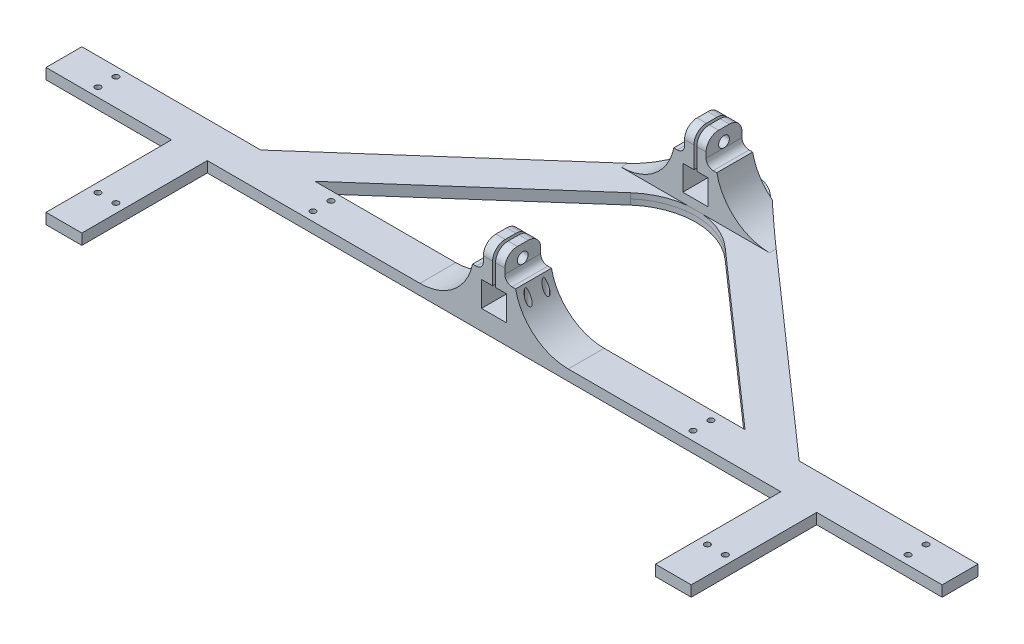
from build123d import *

# Parameters (mm, degrees)
EXTRUDE_1_DEPTH      = 1.5
EXTRUDE_10_DEPTH     = 1.5
FILLET_1_R           = 10
FILLET_2_R           = 20
EXTRUDE_11_DEPTH     = 20
EXTRUDE_13_DEPTH     = 35
EXTRUDE_14_DEPTH     = 35
EXTRUDE_15_DEPTH     = 1.5
FILLET_5_R           = 20
FILLET_6_R           = 10
SKETCH_58_R          = 0.8000000000000042
SKETCH_58_R_2        = 0.8000000000000055
SKETCH_58_R_3        = 0.8000000000000044
SKETCH_58_R_4        = 0.7999999999999963
SKETCH_58_R_5        = 0.8000000000000119
SKETCH_58_R_6        = 0.7999999999999946
SKETCH_58_R_7        = 0.7999999999999954
SKETCH_58_R_8        = 0.7999999999999948
SKETCH_58_R_9        = 0.8000000000000026
CUT_EXTRUDE_52_DEPTH = 145.10569310974057
SKETCH_26_W          = 22
SKETCH_26_H          = 10
EXTRUDE_16_DEPTH     = 20
CUT_EXTRUDE_53_DEPTH = 163.22491745731594
FILLET_7_R           = 15
FILLET_8_R           = 15
FILLET_9_R           = 3.5
SKETCH_60_R          = 1.5000000000000042
CUT_EXTRUDE_54_DEPTH = 147.3444593643323
SKETCH_61_R          = 1.5000000000000004
CUT_EXTRUDE_55_DEPTH = 147.3444593643323
FILLET_10_R          = 2


# Some blends are built 0.0001 mm under size
with BuildPart() as part:
    # 草图1 → 凸台-拉伸1 (new body)
    with BuildSketch(Plane(origin=(0, 0, 0), x_dir=(1, 0, 0), z_dir=(0, 1, 0))):
        Polygon((-125, 4.999999999999984), (124.99999999999996, 4.999999999999984), (124.99999999999996, -5.0000000000000115), (-125.00000000000003, -5.0000000000000115), align=None)
    extrude(amount=EXTRUDE_1_DEPTH)



with BuildPart() as body_2:
    # 草图22 → 凸台-拉伸10 (new body)
    with BuildSketch(Plane.XZ):
        Polygon((-3.09e-14, -71.24835955462486), (-3.362e-14, -57.91502622129154), (-60.00000000000021, -4.9999999999999805), (-75.11857892036937, -4.9999999999999805), align=None)
        Polygon((60.00000000000021, -4.9999999999999645), (1.388e-14, -57.91502622129154), (-3.09e-14, -71.24835955462486), (75.1185789203694, -4.999999999999957), align=None)
    extrude(amount=-EXTRUDE_10_DEPTH)

    # 圆角1
    fillet_1_edges = [body_2.edges().sort_by_distance(p)[0] for p in [
        (-8.35e-15, 0.75, -71.24835955462484),
    ]]
    fillet(fillet_1_edges, radius=FILLET_1_R)

    # 圆角2
    fillet_2_edges = [body_2.edges().sort_by_distance(p)[0] for p in [
        (-9.71e-15, 0.75, -57.91502622129154),
    ]]
    fillet(fillet_2_edges, radius=FILLET_2_R)


with BuildPart() as part_1:
    add(part.part)

    add(body_2.part)  # 凸台-拉伸11 merges body 2
    # 草图24 → 凸台-拉伸11 (add)
    with BuildSketch(Plane(origin=(0, 1.5, 0), x_dir=(1, 0, 0), z_dir=(0, 1, 0))):
        Polygon((-10.000000000000004, 4.999999999999999), (9.999999999999996, 4.999999999999999), (9.999999999999996, -5.000000000000001), (-10.000000000000002, -5.000000000000001), align=None)
    extrude(amount=EXTRUDE_11_DEPTH)

    # 草图41 → 凸台-拉伸13 (add)
    with BuildSketch(Plane.XY.offset(5.0000000000000115)):
        Polygon((89.99999999999996, 1.4999999999999951), (79.99999999999996, 1.4999999999999951), (79.99999999999996, -4.88e-15), (89.99999999999996, -4.99e-15), (89.99999999999996, 0.7499999999999958), align=None)
    extrude(amount=EXTRUDE_13_DEPTH)

    # 草图42 → 凸台-拉伸14 (add)
    with BuildSketch(Plane.XY.offset(5.0000000000000115)):
        Polygon((-80, 1.4999999999999998), (-90, 1.4999999999999998), (-90, 0.75), (-90, -2.2e-16), (-80, -2.2e-16), align=None)
    extrude(amount=EXTRUDE_14_DEPTH)

    # 草图57 → 凸台-拉伸15 (add)
    with BuildSketch(Plane(origin=(0, 0, 0), x_dir=(-1, 0, 0), z_dir=(0, -1, 0))):
        Polygon((125.00000000000003, -5.0000000000000115), (90, -5.0000000000000115), (90, -40.000000000000014), (80, -40.000000000000014), (80, -5.0000000000000115), (-79.99999999999996, -5.0000000000000115), (-79.99999999999996, -40.000000000000014), (-89.99999999999996, -40.000000000000014), (-89.99999999999994, -5.0000000000000115), (-124.99999999999996, -5.0000000000000115), (-124.99999999999996, 4.999999999999984), (-75.11857892036936, 4.999999999999984), (-6.614378277661482, 65.41502622129155), (-3.024e-14, 71.24835955462483), (6.614378277661415, 65.41502622129157), (75.11857892036936, 4.999999999999984), (125, 4.999999999999984), align=None)
        Polygon((60.00000000000022, 4.999999999999984), (-60.00000000000011, 4.999999999999984), (-2.082e-14, 57.915026221291534), align=None, mode=Mode.SUBTRACT)
    extrude(amount=EXTRUDE_15_DEPTH)

    # 圆角5
    fillet_5_edges = [part_1.edges().sort_by_distance(p)[0] for p in [
        (2.082e-14, -0.75, -57.915026221291534),
    ]]
    fillet(fillet_5_edges, radius=FILLET_5_R)

    # 圆角6
    fillet_6_edges = [part_1.edges().sort_by_distance(p)[0] for p in [
        (3.024e-14, -0.75, -71.24835955462483),
    ]]
    fillet(fillet_6_edges, radius=FILLET_6_R)

    # 草图58 → 切除-拉伸52 (cut, through all)
    with BuildSketch(Plane.XZ.offset(1.5)):
        with Locations(Location((7, 2.499999999999986, 0), (0, 0, 270))):
            Circle(SKETCH_58_R)
        with Locations(Location((6.999999999999998, -2.5000000000000147, 0), (0, 0, 270))):
            Circle(SKETCH_58_R_2)
        with Locations(Location((53, 2.5000000000000027, 0), (0, 0, 270))):
            Circle(SKETCH_58_R_3)
        with Locations(Location((53.000000000000014, -2.5000000000000027, 0), (0, 0, 270))):
            Circle(SKETCH_58_R_4)
        with Locations(Location((112.99999999999994, 2.5000000000000138, 0), (0, 0, 270))):
            Circle(SKETCH_58_R_5)
        with Locations(Location((112.99999999999997, -2.500000000000007, 0), (0, 0, 270))):
            Circle(SKETCH_58_R_6)
        with Locations(Location((-87.5, 28.000000000000014, 0), (0, 0, 270))):
            Circle(SKETCH_58_R_7)
        with Locations(Location((-82.49999999999999, 28.000000000000007, 0), (0, 0, 270))):
            Circle(SKETCH_58_R_8)
        with Locations(Location((-112.99999999999996, -2.5, 0), (0, 0, 270))):
            Circle(SKETCH_58_R_7)
        with Locations(Location((-112.99999999999996, 2.4999999999999987, 0), (0, 0, 270))):
            Circle(SKETCH_58_R_7)
        with Locations(Location((-53, -2.5, 0), (0, 0, 270))):
            Circle(SKETCH_58_R_9)
        with Locations(Location((-53, 2.5, 0), (0, 0, 270))):
            Circle(SKETCH_58_R_9)
        with Locations(Location((82.49999999999999, 28.000000000000036, 0), (0, 0, 270))):
            Circle(SKETCH_58_R_7)
        with Locations(Location((87.5, 28.000000000000036, 0), (0, 0, 270))):
            Circle(SKETCH_58_R_7)
    extrude(amount=-CUT_EXTRUDE_52_DEPTH, mode=Mode.SUBTRACT)

    # 草图26 → 凸台-拉伸16 (add)
    with BuildSketch(Plane(origin=(0, 1.5, 0), x_dir=(1, 0, 0), z_dir=(0, 1, 0))):
        with Locations((-1.78e-15, 56.141850111775966)):
            Rectangle(SKETCH_26_W, SKETCH_26_H)
    extrude(amount=EXTRUDE_16_DEPTH)

    # 草图59 → 切除-拉伸53 (cut, through all)
    with BuildSketch(Plane(origin=(1.928e-14, 0, -61.14185011177596), x_dir=(-1, 0, -3.2e-16), z_dir=(3.2e-16, 0, -1))):
        Polygon((5.999999999999998, 13.5), (5.999999999999998, 1.5), (11.000000000000021, 1.5), (11.00000000000002, 21.5), (-10.99999999999998, 21.5), (-10.999999999999979, 1.5), (-6, 1.5), (-6.000000000000002, 13.499999999999996), (-3.0000000000000018, 13.499999999999996), (-3.0000000000000018, 20.499999999999996), (-0.40000000000000174, 20.499999999999996), (-1.73e-15, 20.499999999999996), (0.3999999999999983, 20.499999999999996), (2.9999999999999982, 20.499999999999996), (2.9999999999999982, 13.499999999999996), align=None)
        Polygon((-3.5000000000000013, 4.037645071572423), (-1.78e-15, 4.037645071572423), (3.4999999999999982, 4.037645071572423), (3.4999999999999982, 11.037645071572424), (0.927810105733712, 11.037645071572424), (0.3999999999999977, 11.037645071572424), (-1.78e-15, 11.037645071572424), (-0.4000000000000017, 11.037645071572422), (-3.5000000000000018, 11.037645071572422), align=None)
        Polygon((-0.4000000000000018, 13.499999999999996), (-0.4000000000000018, 11.037645071572424), (-1.78e-15, 11.037645071572424), (0.3999999999999977, 11.037645071572424), (0.3999999999999976, 13.499999999999996), (-1.78e-15, 13.499999999999998), align=None)
        Polygon((-0.40000000000000174, 20.499999999999996), (-0.4000000000000018, 13.499999999999996), (-1.78e-15, 13.499999999999998), (-1.73e-15, 20.499999999999996), align=None)
        Polygon((-1.78e-15, 13.499999999999998), (0.3999999999999977, 13.499999999999998), (0.3999999999999983, 20.499999999999996), (-1.73e-15, 20.499999999999996), align=None)
    extrude(amount=-CUT_EXTRUDE_53_DEPTH, mode=Mode.SUBTRACT)

    # 圆角7
    # the kernel refuses this fillet: 15 mm, written as the material it adds along each edge
    with BuildSketch(Plane(origin=(6.0000000000000195, 1.5, -61.14185011177596), x_dir=(1, 0, 3.2e-16), z_dir=(-3.2e-16, 0, 1))) as fillet_7_piece_1_section:
        with BuildLine():
            CenterArc((14.696938456699067, 15), FILLET_7_R, 191.5369590328155, 78.4630409671845)
            Line((1.78e-15, 11.999999999999996), (0, 0))
            Line((0, 0), (14.696938456699067, 0))
        make_face()
    fillet_7_piece_1 = extrude(amount=9.999999999999993, mode=Mode.PRIVATE)
    fillet_7_piece_1 = split(fillet_7_piece_1, bisect_by=Plane(origin=(8.388620739132056, 1.5, -63.85029144843083), z_dir=(-0.6614378277661448, 0, 0.7500000000000027)), keep=Keep.TOP, mode=Mode.PRIVATE)
    add(fillet_7_piece_1)
    with BuildSketch(Plane(origin=(-5.99999999999998, 1.5, -61.14185011177596), x_dir=(-1, 0, -3.2e-16), z_dir=(-3.2e-16, 0, 1))) as fillet_7_piece_2_section:
        with BuildLine():
            CenterArc((14.696938456699073, -15), FILLET_7_R, 90, 78.46304096718453)
            Line((8.9e-16, -12), (0, 0))
            Line((0, 0), (14.696938456699073, 0))
        make_face()
    fillet_7_piece_2 = extrude(amount=9.999999999999993, mode=Mode.PRIVATE)
    fillet_7_piece_2 = split(fillet_7_piece_2, bisect_by=Plane(origin=(-8.388620739132019, 1.5, -63.85029144843084), z_dir=(0.6614378277661446, 0, 0.7500000000000028)), keep=Keep.TOP, mode=Mode.PRIVATE)
    add(fillet_7_piece_2)

    # 圆角8
    # the kernel refuses this fillet: 15 mm, written as the material it adds along each edge
    with BuildSketch(Plane(origin=(6.000000000000002, 1.5, -4.999999999999986), x_dir=(1, 0, 3.2e-16), z_dir=(-3.2e-16, 0, 1))) as fillet_8_piece_1_section:
        with BuildLine():
            CenterArc((14.69693845669907, 15), FILLET_8_R, 191.5369590328155, 78.4630409671845)
            Line((1.78e-15, 11.999999999999996), (0, 0))
            Line((0, 0), (14.69693845669907, 0))
        make_face()
    fillet_8_piece_1 = extrude(amount=9.999999999999993, mode=Mode.PRIVATE)
    fillet_8_piece_1 = fillet_8_piece_1 - Plane(origin=(6.999999999999998, 1.5, -2.5000000000000147), x_dir=(-1.8e-16, 0, -1), z_dir=(0, -1, 0)) * Cylinder(0.8000000000000055, 79, mode=Mode.PRIVATE)
    fillet_8_piece_1 = fillet_8_piece_1 - Plane(origin=(7, 1.5, 2.499999999999986), x_dir=(-1.8e-16, 0, -1), z_dir=(0, -1, 0)) * Cylinder(0.8000000000000042, 79, mode=Mode.PRIVATE)
    add(fillet_8_piece_1)
    with BuildSketch(Plane(origin=(-5.999999999999997, 1.5, -4.999999999999986), x_dir=(-1, 0, -3.2e-16), z_dir=(-3.2e-16, 0, 1))) as fillet_8_piece_2:
        with BuildLine():
            CenterArc((14.696938456699069, -15), FILLET_8_R, 90, 78.4630409671845)
            Line((8.9e-16, -12), (0, 0))
            Line((0, 0), (14.696938456699069, 0))
        make_face()
    extrude(amount=9.999999999999993)

    # 圆角9
    fillet_9_edges = [part_1.edges().sort_by_distance(p)[0] for p in [
        (-1.6999999999999824, 20.499999999999996, -51.141850111775966),
        (1.700000000000018, 20.499999999999996, -51.141850111775966),
        (1.7000000000000028, 20.499999999999996, 5.000000000000009),
        (1.700000000000021, 20.499999999999996, -61.14185011177596),
        (-1.7000000000000028, 20.499999999999996, 5.000000000000009),
        (-1.699999999999979, 20.499999999999996, -61.14185011177596),
        (1.70000000000001, 20.499999999999996, -4.999999999999985),
        (-1.6999999999999957, 20.499999999999996, -4.999999999999985),
    ]]
    fillet(fillet_9_edges, radius=FILLET_9_R)

    # 草图60 → 切除-拉伸54 (cut, through all)
    with BuildSketch(Plane.ZY.offset(2.9999999999999987)):
        with Locations((-56.14185011177597, 16.999999999999996)):
            Circle(SKETCH_60_R)
    extrude(amount=-CUT_EXTRUDE_54_DEPTH, mode=Mode.SUBTRACT)

    # 草图61 → 切除-拉伸55 (cut, through all)
    with BuildSketch(Plane.ZY.offset(2.9999999999999987)):
        with Locations((4.3e-16, 16.999999999999996)):
            Circle(SKETCH_61_R)
    extrude(amount=-CUT_EXTRUDE_55_DEPTH, mode=Mode.SUBTRACT)

    # 圆角10
    fillet_10_edges = [part_1.edges().sort_by_distance(p)[0] for p in [
        (3.0000000000000018, 13.499999999999996, 7.11e-15),
        (3.000000000000019, 13.499999999999996, -56.141850111775966),
        (-2.9999999999999982, 13.499999999999998, 7.11e-15),
        (-2.999999999999981, 13.499999999999998, -56.141850111775966),
    ]]
    fillet(fillet_10_edges, radius=FILLET_10_R - 0.0001)  # a hair under: the kernel refuses the full size


solid = part_1.part
